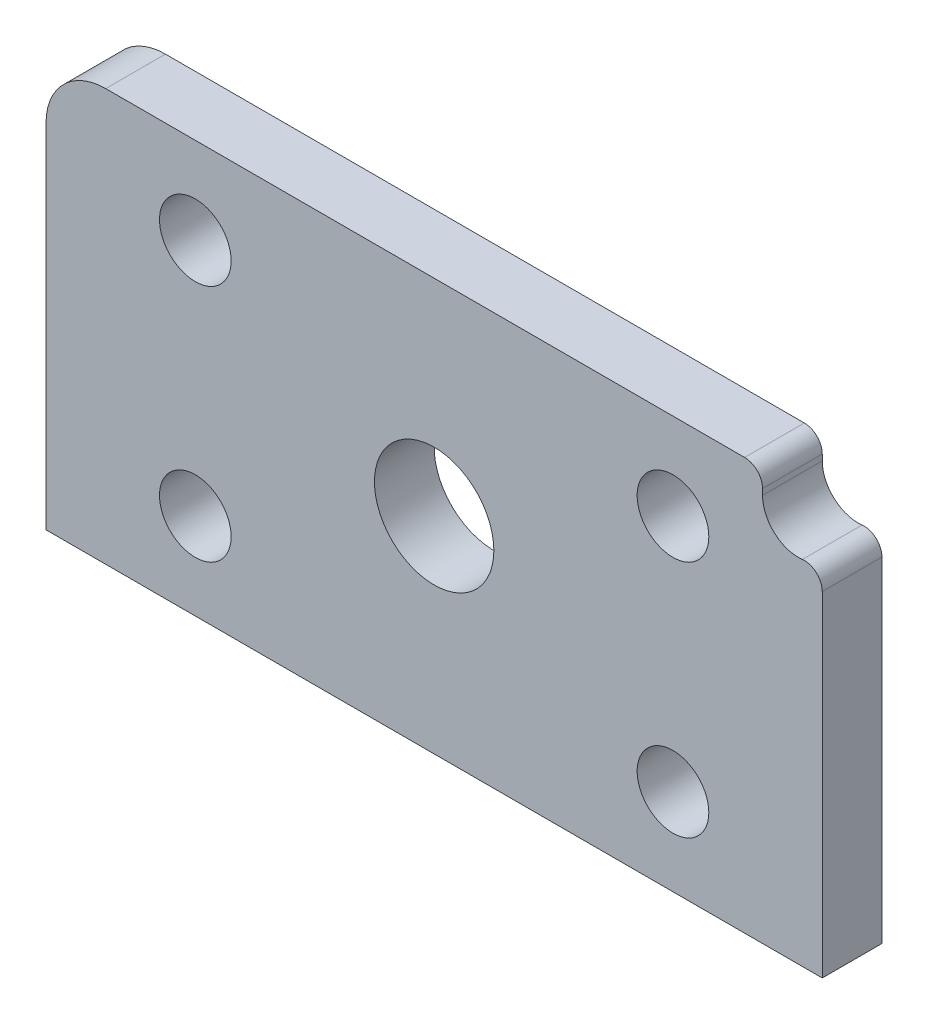
from build123d import *

# Parameters (mm, degrees)
SKETCH1_W          = 130
SKETCH1_H          = 69
BASE_FLANGE1_DEPTH = 10
SKETCH6_R          = 10
SKETCH6_R_2        = 6
CUT_EXTRUDE1_DEPTH = 75.264729179
FILLET1_R          = 10
CUT_EXTRUDE2_DEPTH = 75.264729179
FILLET2_R          = 3


# Sheet-metal steps are written as plain solids
with BuildPart() as part:
    # Sketch1 → Base-Flange1 (new body)
    with BuildSketch(Plane.XY):
        Rectangle(SKETCH1_W, SKETCH1_H)
    extrude(amount=-BASE_FLANGE1_DEPTH)

    # Sketch6 → Cut-Extrude1 (cut, through all)
    with BuildSketch(Plane.XY):
        Circle(SKETCH6_R)
        with Locations((-40, 20)):
            Circle(SKETCH6_R_2)
        with Locations((-40, -20)):
            Circle(SKETCH6_R_2)
        with Locations((40, -20)):
            Circle(SKETCH6_R_2)
        with Locations((40, 20)):
            Circle(SKETCH6_R_2)
    extrude(amount=-CUT_EXTRUDE1_DEPTH, mode=Mode.SUBTRACT)

    # Fillet1
    fillet1_edges = [part.edges().sort_by_distance(p)[0] for p in [
        (-65, 34.5, -5),
        (65, 34.5, -5),
    ]]
    fillet(fillet1_edges, radius=FILLET1_R)

    # Sketch7 → Cut-Extrude2 (cut, through all)
    with BuildSketch(Plane.XY):
        with BuildLine():
            Line((67, 34.5), (67, 30.5))
            ThreePointArc((67, 30.5), (61, 24.5), (55, 30.5))
            Line((55, 30.5), (55, 34.5))
            ThreePointArc((55, 34.5), (61, 40.5), (67, 34.5))
        make_face()
    extrude(amount=-CUT_EXTRUDE2_DEPTH, mode=Mode.SUBTRACT)

    # Fillet2
    fillet2_edges = [part.edges().sort_by_distance(p)[0] for p in [
        (55, 34.5, -5),
        (64.896192513, 25.93714082, -5),
    ]]
    fillet(fillet2_edges, radius=FILLET2_R)


solid = part.part
